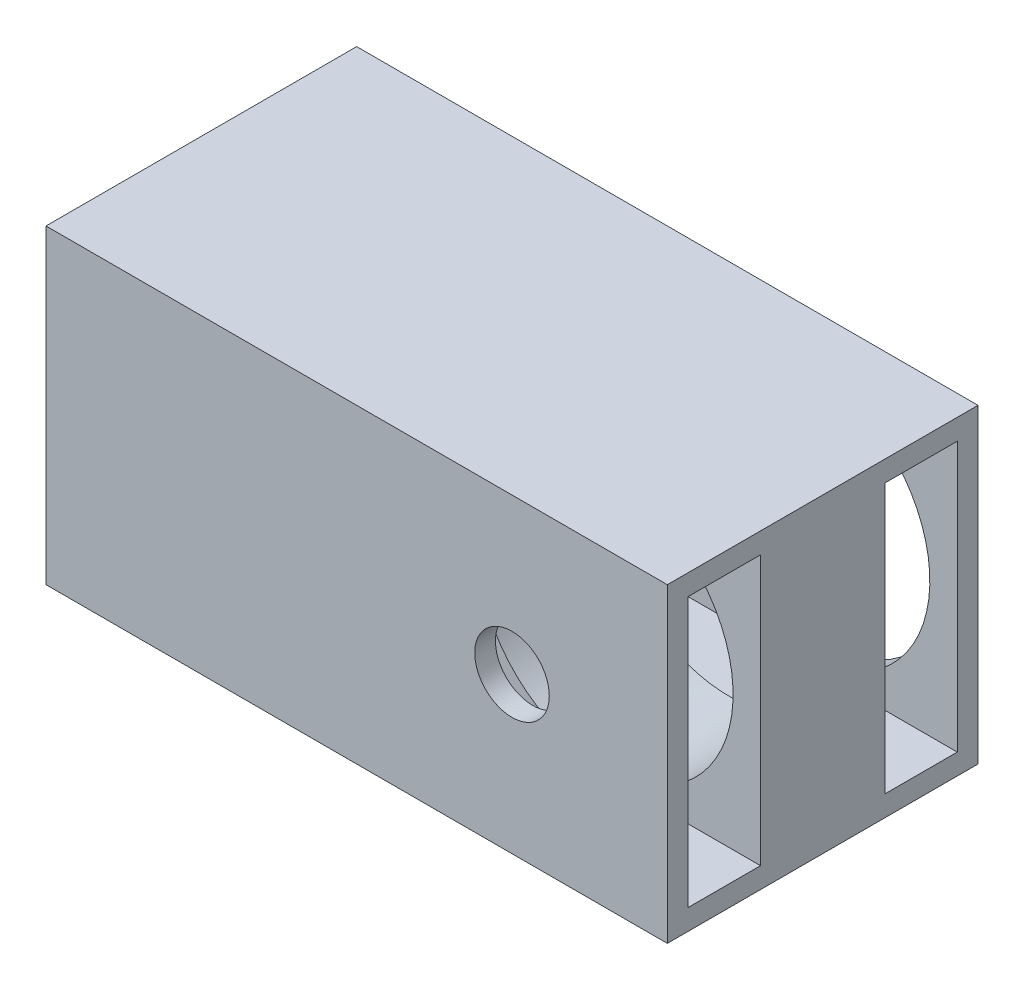
from build123d import *

# Parameters (mm, degrees)
SKETCH1_W           = 30
SKETCH1_H           = 30
SKETCH1_W_2         = 7
SKETCH1_H_2         = 26
BOSS_EXTRUDE3_DEPTH = 60
SKETCH6_R           = 12.35
CUT_EXTRUDE5_DEPTH  = 23
SKETCH8_R           = 3.6
CUT_EXTRUDE6_DEPTH  = 17


with BuildPart() as part:
    # Sketch1 → Boss-Extrude3 (new body)
    with BuildSketch(Plane(origin=(0, 0, 0), x_dir=(0, 0, -1), z_dir=(1, 0, 0))):
        Rectangle(SKETCH1_W, SKETCH1_H)
        with Locations((-9.5, 0)):
            Rectangle(SKETCH1_W_2, SKETCH1_H_2, mode=Mode.SUBTRACT)
        with Locations((9.5, 0)):
            Rectangle(SKETCH1_W_2, SKETCH1_H_2, mode=Mode.SUBTRACT)
    extrude(amount=BOSS_EXTRUDE3_DEPTH)

    # Sketch6 → Cut-Extrude5 (cut)
    with BuildSketch(Plane(origin=(0, 0, -15), x_dir=(-1, 0, 0), z_dir=(0, 0, -1))):
        with Locations((-45, 0)):
            Circle(SKETCH6_R)
    extrude(amount=-CUT_EXTRUDE5_DEPTH, mode=Mode.SUBTRACT)

    # Sketch8 → Cut-Extrude6 (cut)
    with BuildSketch(Plane.XY.offset(15)):
        with Locations((45, 0)):
            Circle(SKETCH8_R)
    extrude(amount=-CUT_EXTRUDE6_DEPTH, mode=Mode.SUBTRACT)


solid = part.part
